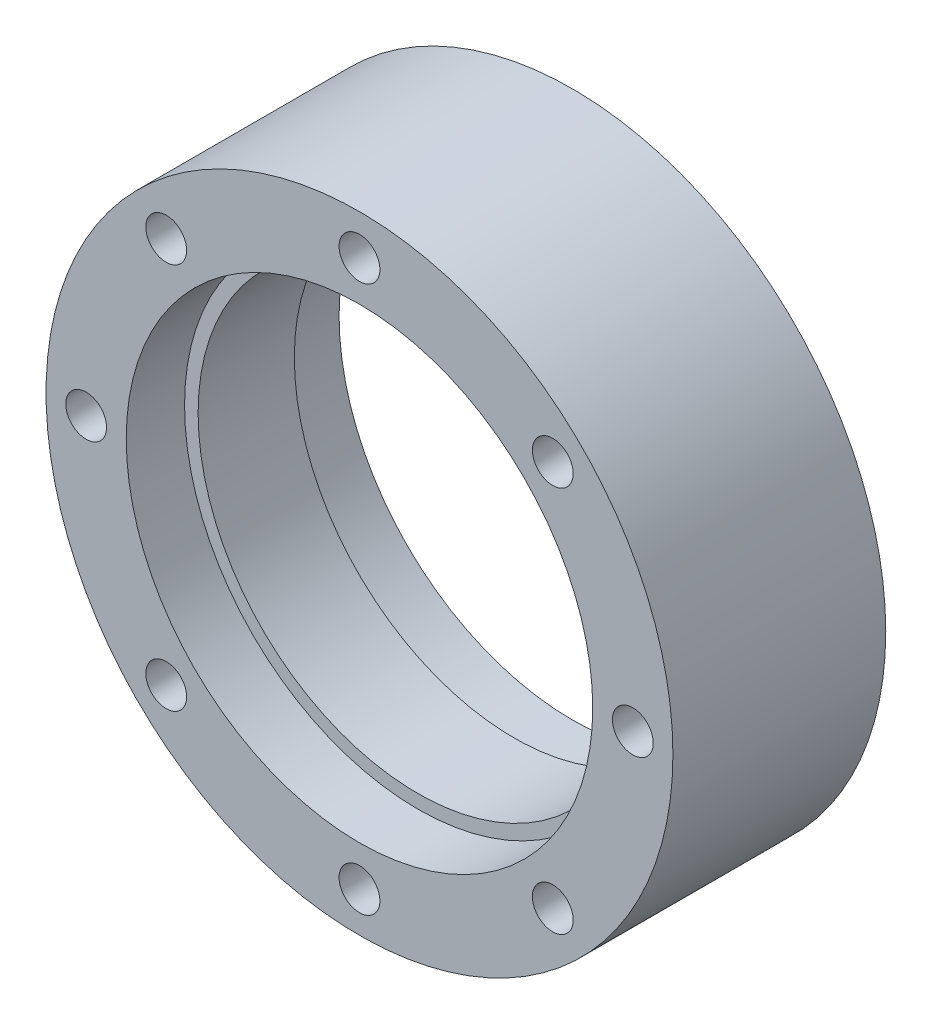
from build123d import *

# Parameters (mm, degrees)
SKETCH3_R          = 1.4
CUT_EXTRUDE2_DEPTH = 32.269633832
CUT_EXTRUDE4_START = -2.5
SKETCH4_R          = 2.35
CUT_EXTRUDE4_DEPTH = 37.229215822
CHAMFER1_SIZE      = 0.1
CIRPATTERN3_COUNT  = 4
CIRPATTERN2_COUNT  = 8


with BuildPart() as part:
    # Sketch7 → Revolve1 (revolve)
    with BuildSketch(Plane(origin=(0, 0, 0), x_dir=(1, 0, 0), z_dir=(0, 1, 0))):
        Polygon((16, 7.3), (16, 3.3), (15.07, 3.3), (15.07, -3.3), (16, -3.3), (16, -7.3), (21.5, -7.3), (21.5, 7.3), align=None)
    revolve(axis=Axis((0, 0, 8.03), (0, 0, -1)))

    # Sketch3 → Cut-Extrude2 (cut, symmetric)
    with BuildSketch(Plane.XY):
        with Locations((0, 18.75)):
            Circle(SKETCH3_R)
    cut_extrude2 = extrude(amount=CUT_EXTRUDE2_DEPTH, both=True, mode=Mode.SUBTRACT)

    # Sketch4 → Cut-Extrude4 (cut)
    with BuildSketch(Plane(origin=(0, 0, -7.3), x_dir=(-1, 0, 0), z_dir=(0, 0, -1)).offset(CUT_EXTRUDE4_START)):
        with Locations((0, 18.75)):
            Circle(SKETCH4_R)
    cut_extrude4 = extrude(amount=CUT_EXTRUDE4_DEPTH, mode=Mode.SUBTRACT)

    # Chamfer1
    chamfer1_edges = [part.edges().sort_by_distance(p)[0] for p in [
        (-1.4, 18.75, -4.8),
    ]]
    chamfer(chamfer1_edges, length=CHAMFER1_SIZE)

    # CirPattern3: Cut-Extrude4 ×4 about axis
    cirpattern3_axis = Axis((0, 0, 8.03), (0, 0, -1))
    for i in range(1, CIRPATTERN3_COUNT):
        add(cut_extrude4.rotate(cirpattern3_axis, i * 360 / CIRPATTERN3_COUNT), mode=Mode.SUBTRACT)

    # CirPattern2: Cut-Extrude2 ×8 about axis
    cirpattern2_axis = Axis((0, 0, 8.03), (0, 0, -1))
    for i in range(1, CIRPATTERN2_COUNT):
        add(cut_extrude2.rotate(cirpattern2_axis, i * 360 / CIRPATTERN2_COUNT), mode=Mode.SUBTRACT)


solid = part.part
